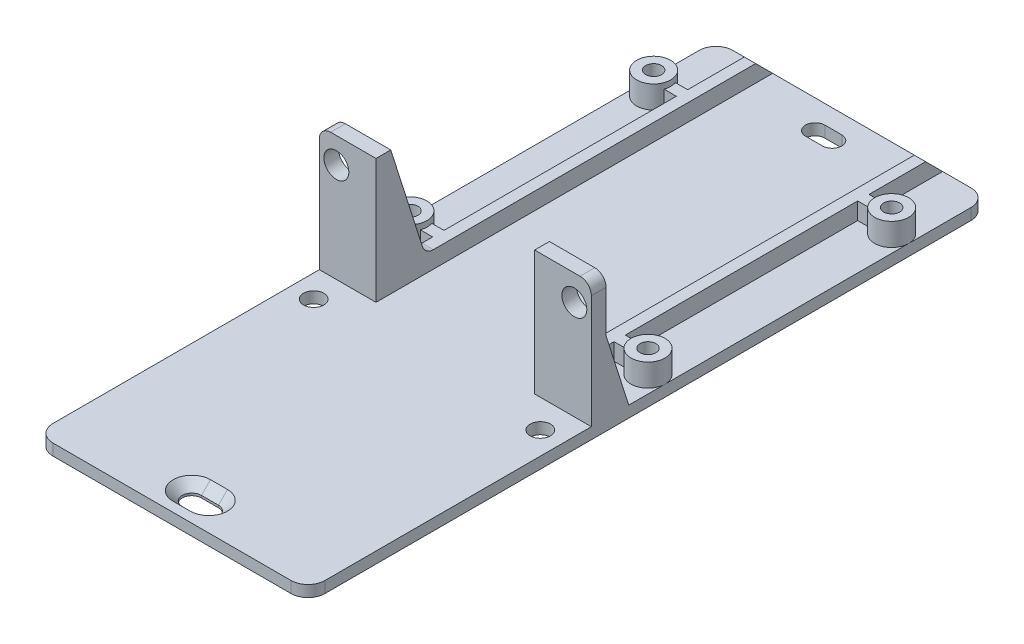
from build123d import *

# Parameters (mm, degrees)
SKETCH_1_W             = 48
SKETCH_1_H             = 120
EXTRUDE_1_DEPTH        = 2
SKETCH_2_R             = 1.7
CUT_EXTRUDE_1_DEPTH    = 65.652919501
FILLET_1_R             = 3
SKETCH_3_R             = 1.8
CUT_EXTRUDE_2_DEPTH    = 2
SKETCH_4_W             = 10
SKETCH_4_H             = 2.6
EXTRUDE_2_DEPTH        = 22
RIB_6_REACH            = 76.967
SKETCH_5_WALL_W        = 175.020111274
SKETCH_5_WALL_H        = 2
SKETCH_6_R             = 2.2
CUT_EXTRUDE_3_DEPTH    = 76.463633626
FILLET_2_R             = 2
RIB_START              = -2
RIB_7_DEPTH            = 2
SKETCH_9_R             = 1.4
CUT_EXTRUDE_4_DEPTH    = 69.264192664
SKETCH_10_W            = 2
SKETCH_10_H            = 61.770189923
EXTRUDE_3_DEPTH        = 3
FILLET_3_R             = 2
CHAMFER_2_SIZE         = 3
HOLE_START             = -1
HOLE_WIZARD_M3_1_DEPTH = 4
EXTRUDE_START          = 4
SKETCH_14_R            = 3
SKETCH_14_R_2          = 1.4
EXTRUDE_4_DEPTH        = 4
SKETCH_15_W            = 4.171572875
SKETCH_15_H            = 2
EXTRUDE_5_DEPTH        = 3


with BuildPart() as part:
    # 草图1 → 凸台-拉伸1 (new body)
    with BuildSketch(Plane(origin=(0, 0, 0), x_dir=(1, 0, 0), z_dir=(0, 1, 0))):
        Rectangle(SKETCH_1_W, SKETCH_1_H)
    extrude(amount=EXTRUDE_1_DEPTH)

    # 草图2 → 切除-拉伸1 (cut, through all)
    with BuildSketch(Plane(origin=(0, 2, 0), x_dir=(1, 0, 0), z_dir=(0, 1, 0))):
        with Locations(Location((0, -55, 0), (0, 0, 90))):
            Circle(SKETCH_2_R)
        with BuildLine():
            Line((-1.5, 56.7), (1.5, 56.7))
            ThreePointArc((1.5, 56.7), (3.2, 55), (1.5, 53.3))
            Line((1.5, 53.3), (-1.5, 53.3))
            ThreePointArc((-1.5, 53.3), (-3.2, 55), (-1.5, 56.7))
        make_face()
    extrude(amount=-CUT_EXTRUDE_1_DEPTH, mode=Mode.SUBTRACT)

    # 圆角1
    fillet_1_edges = [part.edges().sort_by_distance(p)[0] for p in [
        (24, 1, 60),
        (-24, 1, 60),
        (-24, 1, -60),
        (24, 1, -60),
    ]]
    fillet(fillet_1_edges, radius=FILLET_1_R)

    # 草图3 → 切除-拉伸2 (cut)
    with BuildSketch(Plane(origin=(0, 0, 0), x_dir=(-1, 0, 0), z_dir=(0, -1, 0))):
        with Locations(Location((20, -15, 0), (0, 0, 90))):
            Circle(SKETCH_3_R)
        with Locations(Location((-20, -15, 0), (0, 0, 90))):
            Circle(SKETCH_3_R)
    extrude(amount=-CUT_EXTRUDE_2_DEPTH, mode=Mode.SUBTRACT)

    # 草图4 → 凸台-拉伸2 (add)
    with BuildSketch(Plane(origin=(0, 2, 0), x_dir=(1, 0, 0), z_dir=(0, 1, 0))):
        with Locations((19, -8.7)):
            Rectangle(SKETCH_4_W, SKETCH_4_H)
        with Locations((-19, -8.7)):
            Rectangle(SKETCH_4_W, SKETCH_4_H)
    extrude(amount=EXTRUDE_2_DEPTH)

    # 草图5 wall → 筋6 (add, up to next)
    with BuildSketch(Plane(origin=(14, 13, 3.9), x_dir=(0, -0.952925780013, -0.303203657277), z_dir=(0, -0.303203657277, 0.952925780013)), mode=Mode.PRIVATE) as rib_6_sk1:
        with Locations((0, 1)):
            Rectangle(SKETCH_5_WALL_W, SKETCH_5_WALL_H)
    rib_6_tool1 = extrude(rib_6_sk1.sketch, amount=RIB_6_REACH, mode=Mode.PRIVATE) - part.part
    rib_6 = rib_6_tool1.solids().sort_by_distance((14, 13, 3.9))[0]
    add(rib_6)

    # 镜向1: 筋6 across plane
    add(rib_6.mirror(Plane(origin=(0, 0, 0), x_dir=(0, 0, 1), z_dir=(1, 0, 0))))

    # 草图6 → 切除-拉伸3 (cut, through all)
    with BuildSketch(Plane(origin=(0, 0, 7.4), x_dir=(-1, 0, 0), z_dir=(0, 0, -1))):
        with Locations((-21, 19.5)):
            Circle(SKETCH_6_R)
        with Locations((21, 19.5)):
            Circle(SKETCH_6_R)
    extrude(amount=-CUT_EXTRUDE_3_DEPTH, mode=Mode.SUBTRACT)

    # 圆角2
    fillet_2_edges = [part.edges().sort_by_distance(p)[0] for p in [
        (24, 24, 8.7),
        (-24, 24, 8.7),
    ]]
    fillet(fillet_2_edges, radius=FILLET_2_R)

    # 筋7: read off the stored shape, not the designer's step
    # 筋7 outline → 筋7 (add)
    with BuildSketch(Plane(origin=(24, 0, 0), x_dir=(0, 0, -1), z_dir=(1, 0, 0)).offset(RIB_START)):
        Polygon((-3.4, 2), (-7.4, 14.571428571), (-7.4, 2), align=None)
    rib_7 = extrude(amount=RIB_7_DEPTH)

    # 镜向2: 筋7 across plane
    add(rib_7.mirror(Plane(origin=(0, 0, 0), x_dir=(0, 0, 1), z_dir=(1, 0, 0))))

    # 草图9 → 切除-拉伸4 (cut, through all)
    with BuildSketch(Plane(origin=(0, 2, 0), x_dir=(1, 0, 0), z_dir=(0, 1, 0))):
        with Locations(Location((-21, 46, 0), (0, 0, 270))):
            Circle(SKETCH_9_R)
        with Locations(Location((21, 46, 0), (0, 0, 270))):
            Circle(SKETCH_9_R)
        with Locations(Location((21, 3, 0), (0, 0, 270))):
            Circle(SKETCH_9_R)
        with Locations(Location((-21, 3, 0), (0, 0, 270))):
            Circle(SKETCH_9_R)
    extrude(amount=-CUT_EXTRUDE_4_DEPTH, mode=Mode.SUBTRACT)

    # 草图10 → 凸台-拉伸3 (add)
    with BuildSketch(Plane(origin=(0, 2, 0), x_dir=(1, 0, 0), z_dir=(0, 1, 0))):
        with Locations((-15, 29.114905039)):
            Rectangle(SKETCH_10_W, SKETCH_10_H)
        with Locations((15, 29.114905039)):
            Rectangle(SKETCH_10_W, SKETCH_10_H)
    extrude(amount=EXTRUDE_3_DEPTH)

    # 圆角3
    fillet_3_edges = [part.edges().sort_by_distance(p)[0] for p in [
        (-15, 5, 1.354545455),
        (15, 5, 1.354545455),
    ]]
    fillet(fillet_3_edges, radius=FILLET_3_R)

    # 倒角2
    chamfer_2_edges = [part.edges().sort_by_distance(p)[0] for p in [
        (15, 5, -60),
        (-15, 5, -60),
    ]]
    chamfer(chamfer_2_edges, length=CHAMFER_2_SIZE)

    # M3 十字槽沉头木螺钉的锥形沉头孔1: read off the stored shape, not the designer's step
    # M3 十字槽沉头木螺钉的锥形沉头孔1 outline → M3 十字槽沉头木螺钉的锥形沉头孔1 (cut)
    with BuildSketch(Plane(origin=(0, 0, 0), x_dir=(1, 0, 0), z_dir=(0, 1, 0)).offset(HOLE_START)):
        with BuildLine():
            Line((0, -56.7), (1.5, -56.7))
            ThreePointArc((1.5, -56.7), (3.2, -55), (1.5, -53.3))
            Line((1.5, -53.3), (0, -53.3))
            ThreePointArc((0, -53.3), (1.7, -55), (0, -56.7))
        make_face()
        with BuildLine():
            Line((-1.5, -56.7), (0, -56.7))
            ThreePointArc((0, -56.7), (-1.7, -55), (0, -53.3))
            Line((0, -53.3), (-1.5, -53.3))
            ThreePointArc((-1.5, -53.3), (-3.2, -55), (-1.5, -56.7))
        make_face()
    extrude(amount=HOLE_WIZARD_M3_1_DEPTH, mode=Mode.SUBTRACT)

    # Hole Wizard M3 _1 2: loft between two sections, ruled curve by curve
    hole_wizard_m3_1_2_from = [
        Edge.make_three_point_arc((1.5, 0.4, 56.7), (2.702081528, 0.4, 56.202081528), (3.2, 0.4, 55)),
        Edge.make_three_point_arc((3.2, 0.4, 55), (2.702081528, 0.4, 53.797918472), (1.5, 0.4, 53.3)),
        Edge.make_three_point_arc((-1.5, 0.4, 53.3), (-2.702081528, 0.4, 53.797918472), (-3.2, 0.4, 55)),
        Edge.make_three_point_arc((-3.2, 0.4, 55), (-2.702081528, 0.4, 56.202081528), (-1.5, 0.4, 56.7)),
        Edge.make_line((1.5, 0.4, 53.3), (-1.5, 0.4, 53.3)),
        Edge.make_line((1.5, 0.4, 56.7), (-1.5, 0.4, 56.7)),
    ]
    hole_wizard_m3_1_2_to = [
        Edge.make_three_point_arc((1.5, 2, 58.3), (3.833452378, 2, 57.333452378), (4.8, 2, 55)),
        Edge.make_three_point_arc((4.8, 2, 55), (3.833452378, 2, 52.666547622), (1.5, 2, 51.7)),
        Edge.make_three_point_arc((-1.5, 2, 51.7), (-3.833452378, 2, 52.666547622), (-4.8, 2, 55)),
        Edge.make_three_point_arc((-4.8, 2, 55), (-3.833452378, 2, 57.333452378), (-1.5, 2, 58.3)),
        Edge.make_line((1.5, 2, 51.7), (-1.5, 2, 51.7)),
        Edge.make_line((1.5, 2, 58.3), (-1.5, 2, 58.3)),
    ]
    hole_wizard_m3_1_2 = Solid(Shell([*[Face.make_surface_from_curves(hole_wizard_m3_1_2_from[k], hole_wizard_m3_1_2_to[k]) for k in range(6)], Face(Wire(hole_wizard_m3_1_2_from)), Face(Wire(hole_wizard_m3_1_2_to))]))
    add(hole_wizard_m3_1_2, mode=Mode.SUBTRACT)

    # 草图14 → 凸台-拉伸4 (add)
    # profile 1 of 4: a face of its own
    with BuildSketch(Plane(origin=(0, 2, 0), x_dir=(1, 0, 0), z_dir=(0, 1, 0)).offset(EXTRUDE_START)):
        with Locations(Location((-21, 46, 0), (0, 0, 180))):
            Circle(SKETCH_14_R)
        with Locations(Location((-21, 46, 0), (0, 0, 270))):
            Circle(SKETCH_14_R_2, mode=Mode.SUBTRACT)
    # profile 2 of 4: a face of its own
    with BuildSketch(Plane(origin=(0, 2, 0), x_dir=(1, 0, 0), z_dir=(0, 1, 0)).offset(EXTRUDE_START)):
        with Locations(Location((-21, 3, 0), (0, 0, 180))):
            Circle(SKETCH_14_R)
        with Locations(Location((-21, 3, 0), (0, 0, 270))):
            Circle(SKETCH_14_R_2, mode=Mode.SUBTRACT)
    # profile 3 of 4: a face of its own
    with BuildSketch(Plane(origin=(0, 2, 0), x_dir=(1, 0, 0), z_dir=(0, 1, 0)).offset(EXTRUDE_START)):
        with Locations((21, 46)):
            Circle(SKETCH_14_R)
        with Locations(Location((21, 46, 0), (0, 0, 270))):
            Circle(SKETCH_14_R_2, mode=Mode.SUBTRACT)
    # profile 4 of 4: a face of its own
    with BuildSketch(Plane(origin=(0, 2, 0), x_dir=(1, 0, 0), z_dir=(0, 1, 0)).offset(EXTRUDE_START)):
        with Locations((21, 3)):
            Circle(SKETCH_14_R)
        with Locations(Location((21, 3, 0), (0, 0, 270))):
            Circle(SKETCH_14_R_2, mode=Mode.SUBTRACT)
    extrude(amount=-EXTRUDE_4_DEPTH)

    # 草图15 → 凸台-拉伸5 (add)
    with BuildSketch(Plane(origin=(0, 5, 0), x_dir=(1, 0, 0), z_dir=(0, 1, 0))):
        with Locations((-16.085786438, 46)):
            Rectangle(SKETCH_15_W, SKETCH_15_H)
        with Locations((-16.085786438, 3)):
            Rectangle(SKETCH_15_W, SKETCH_15_H)
        with Locations((16.085786438, 3)):
            Rectangle(SKETCH_15_W, SKETCH_15_H)
        with Locations((16.085786438, 46)):
            Rectangle(SKETCH_15_W, SKETCH_15_H)
    extrude(amount=-EXTRUDE_5_DEPTH)


solid = part.part
